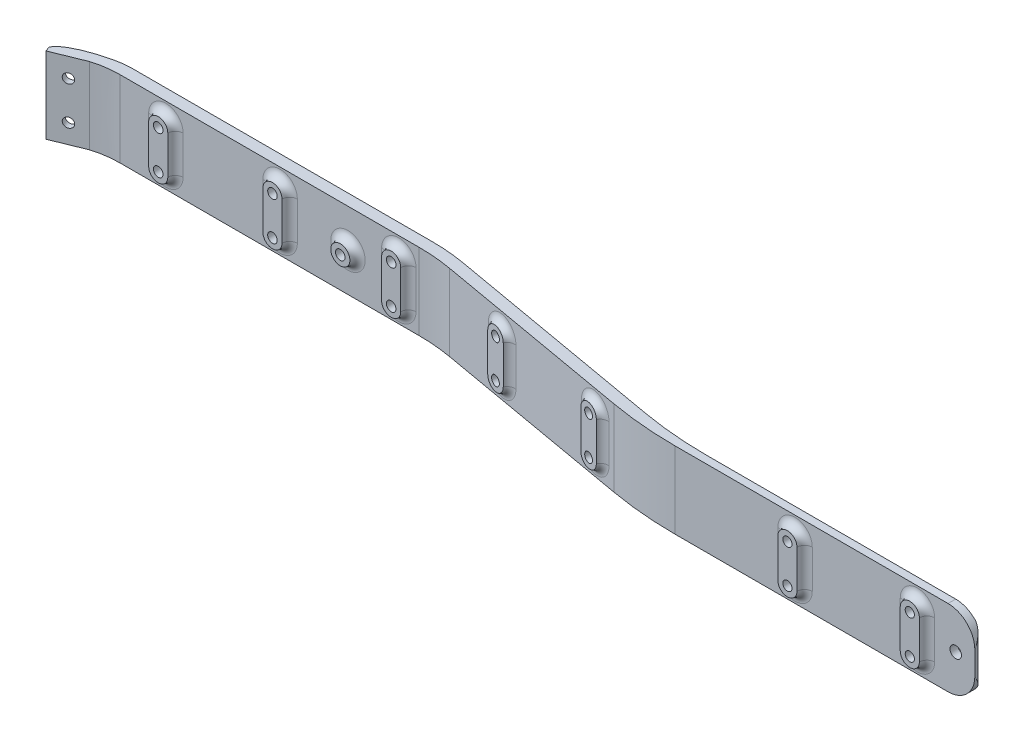
from build123d import *

# Parameters (mm, degrees)
EXTRUDE_1_DEPTH     = 20
SKETCH_2_R          = 1.25
SKETCH_2_R_2        = 1.2
SKETCH_2_R_3        = 1.5
CUT_EXTRUDE_1_DEPTH = 20
SKETCH_3_R          = 1.25
CUT_EXTRUDE_2_DEPTH = 10
SKETCH_6_R          = 1.25
CUT_EXTRUDE_3_DEPTH = 10
CUT_EXTRUDE_START   = -1.5
SKETCH_7_R          = 2.5
CUT_EXTRUDE_4_DEPTH = 10
FILLET_2_R          = 7
FILLET_4_R          = 2
SKETCH_8_R          = 2.5
SKETCH_8_R_2        = 1.25
EXTRUDE_2_DEPTH     = 2
SKETCH_9_R          = 1.2
EXTRUDE_3_DEPTH     = 2
SKETCH_10_R         = 1.25
EXTRUDE_4_DEPTH     = 1.5
FILLET_5_R          = 2


with BuildPart() as part:
    # Эскиз1 → Бобышка-Вытянуть1 (new body)
    with BuildSketch(Plane(origin=(0, 0, 0), x_dir=(1, 0, 0), z_dir=(0, 1, 0))):
        with BuildLine():
            add(Edge.make_bspline(
                [(11.586456911, 0), (7.354184674, -0.068879004), (-2.292700231, -2.973629634), (-3.594429032, -6.084373142)],
                knots=[0.023541254, 0.023541254, 0.023541254, 0.023541254, 1, 1, 1, 1], degree=3))
            Line((-3.594429032, -6.084373142), (-3.125717465, -7.311245307))
            Line((-3.125717465, -7.311245307), (4.944424909, -4.027038302))
            add(Edge.make_bspline(
                [(4.944424909, -4.027038302), (8.036327036, -3.034882344), (11.882927706, -3)],
                knots=[0, 0, 0, 1, 1, 1], degree=2))
            Line((11.882927706, -3), (90.096585882, -3))
            ThreePointArc((90.096585882, -3), (94.454373019, -3.190265095), (98.778994765, -3.759612349))
            Line((98.778994765, -3.759612349), (151.074808569, -12.980775301))
            ThreePointArc((151.074808569, -12.980775301), (159.724052061, -14.119469809), (168.439626336, -14.5))
            Line((168.439626336, -14.5), (246.882927706, -14.5))
            Line((246.882927706, -14.5), (246.882927706, -12.5))
            Line((246.882927706, -12.5), (174.639889098, -12.5))
            ThreePointArc((174.639889098, -12.5), (165.924314823, -12.119469809), (157.275071331, -10.980775301))
            Line((157.275071331, -10.980775301), (99.307975707, -0.759612349))
            ThreePointArc((99.307975707, -0.759612349), (97.143592887, -0.426667086), (94.966707435, -0.188811516))
            ThreePointArc((94.966707435, -0.188811516), (92.798189179, -0.047225181), (90.625566824, 0))
            Line((90.625566824, 0), (11.586456911, 0))
        make_face()
    extrude(amount=EXTRUDE_1_DEPTH)

    # Эскиз2 → Вырез-Вытянуть1 (cut)
    with BuildSketch(Plane(origin=(0, 0, 0), x_dir=(-1, 0, 0), z_dir=(0, 0, -1))):
        with Locations((-23.901835852, 5)):
            Circle(SKETCH_2_R)
        with Locations((-23.901835852, 15)):
            Circle(SKETCH_2_R)
        with Locations((-53.767576073, 15)):
            Circle(SKETCH_2_R)
        with Locations((-53.767576073, 5)):
            Circle(SKETCH_2_R)
        with Locations((-71.5, 10)):
            Circle(SKETCH_2_R)
        with Locations((-84.8, 15)):
            Circle(SKETCH_2_R)
        with Locations((-84.8, 5)):
            Circle(SKETCH_2_R)
        with Locations((-231.882927706, 5)):
            Circle(SKETCH_2_R_2)
        with Locations((-199.882927706, 5)):
            Circle(SKETCH_2_R_2)
        with Locations((-199.882927706, 15)):
            Circle(SKETCH_2_R_2)
        with Locations((-231.882927706, 15)):
            Circle(SKETCH_2_R_2)
        with Locations((-241.882927706, 10)):
            Circle(SKETCH_2_R_3)
    extrude(amount=-CUT_EXTRUDE_1_DEPTH, mode=Mode.SUBTRACT)

    # Эскиз3 → Вырез-Вытянуть2 (cut)
    with BuildSketch(Plane(origin=(2.864600513, 0, -16.245956808), x_dir=(-0.9848077530122085, 0, -0.17364817766692825), z_dir=(0.17364817766692825, 0, -0.9848077530122085))):
        with Locations((-114.931169712, 15)):
            Circle(SKETCH_3_R)
        with Locations((-144.931169712, 15)):
            Circle(SKETCH_3_R)
        with Locations((-114.931169712, 5)):
            Circle(SKETCH_3_R)
        with Locations((-144.931169712, 5)):
            Circle(SKETCH_3_R)
    extrude(amount=-CUT_EXTRUDE_2_DEPTH, mode=Mode.SUBTRACT)

    # Эскиз6 → Вырез-Вытянуть3 (cut)
    with BuildSketch(Plane(origin=(2.107232026, 0, 5.181655942), x_dir=(0.926237816407285, 0, -0.37693966023365694), z_dir=(0.3769396602336569, 0, 0.9262378164072849))):
        with Locations((-1.149682401, 15)):
            Circle(SKETCH_6_R)
        with Locations((-1.149682401, 5)):
            Circle(SKETCH_6_R)
    extrude(amount=-CUT_EXTRUDE_3_DEPTH, mode=Mode.SUBTRACT)

    # Эскиз7 → Вырез-Вытянуть4 (cut)
    with BuildSketch(Plane(origin=(2.107232026, 0, 5.181655942), x_dir=(0.926237816407285, 0, -0.37693966023365694), z_dir=(0.3769396602336569, 0, 0.9262378164072849)).offset(CUT_EXTRUDE_START)):
        with Locations((-1.149682401, 15)):
            Circle(SKETCH_7_R)
        with Locations((-1.149682401, 5)):
            Circle(SKETCH_7_R)
    extrude(amount=-CUT_EXTRUDE_4_DEPTH, mode=Mode.SUBTRACT)

    # Скругление2
    fillet_2_edges = [part.edges().sort_by_distance(p)[0] for p in [
        (246.882927706, 0, 13.5),
        (246.882927706, 20, 13.5),
    ]]
    fillet(fillet_2_edges, radius=FILLET_2_R)

    # Скругление4
    # the kernel refuses this fillet: 2 mm, written as the material it takes off along each edge
    with BuildSketch(Plane(origin=(246.882927706, 2, 12.5), x_dir=(0, 0, 1), z_dir=(0, 1, 0))) as fillet_4_piece_1:
        with BuildLine():
            CenterArc((FILLET_4_R, -FILLET_4_R), FILLET_4_R, 90, 90)
            Line((0, -FILLET_4_R), (0, 0))
            Line((0, 0), (FILLET_4_R, 0))
        make_face()
    extrude(amount=16, mode=Mode.SUBTRACT)

    # Эскиз8 → Бобышка-Вытянуть2 (add)
    # profile 1 of 4: a face of its own
    with BuildSketch(Plane.XY.offset(3)):
        with Locations((71.5, 10)):
            Circle(SKETCH_8_R)
        with Locations(Location((71.5, 10, 0), (0, 0, 180))):
            Circle(SKETCH_8_R_2, mode=Mode.SUBTRACT)
    # profile 2 of 4: a face of its own
    with BuildSketch(Plane.XY.offset(3)):
        with BuildLine():
            Line((21.401835852, 15), (21.401835852, 5))
            ThreePointArc((21.401835852, 5), (23.901835852, 2.5), (26.401835852, 5))
            Line((26.401835852, 5), (26.401835852, 15))
            ThreePointArc((26.401835852, 15), (23.901835852, 17.5), (21.401835852, 15))
        make_face()
        with Locations(Location((23.901835852, 15, 0), (0, 0, 180))):
            Circle(SKETCH_8_R_2, mode=Mode.SUBTRACT)
        with Locations(Location((23.901835852, 5, 0), (0, 0, 180))):
            Circle(SKETCH_8_R_2, mode=Mode.SUBTRACT)
    # profile 3 of 4: a face of its own
    with BuildSketch(Plane.XY.offset(3)):
        with BuildLine():
            Line((56.267576073, 5), (56.267576073, 15))
            ThreePointArc((56.267576073, 15), (53.767576073, 17.5), (51.267576073, 15))
            Line((51.267576073, 15), (51.267576073, 5))
            ThreePointArc((51.267576073, 5), (53.767576073, 2.5), (56.267576073, 5))
        make_face()
        with Locations(Location((53.767576073, 15, 0), (0, 0, 180))):
            Circle(SKETCH_8_R_2, mode=Mode.SUBTRACT)
        with Locations(Location((53.767576073, 5, 0), (0, 0, 180))):
            Circle(SKETCH_8_R_2, mode=Mode.SUBTRACT)
    # profile 4 of 4: a face of its own
    with BuildSketch(Plane.XY.offset(3)):
        with BuildLine():
            Line((87.3, 5), (87.3, 15))
            ThreePointArc((87.3, 15), (84.8, 17.5), (82.3, 15))
            Line((82.3, 15), (82.3, 5))
            ThreePointArc((82.3, 5), (84.8, 2.5), (87.3, 5))
        make_face()
        with Locations(Location((84.8, 15, 0), (0, 0, 180))):
            Circle(SKETCH_8_R_2, mode=Mode.SUBTRACT)
        with Locations(Location((84.8, 5, 0), (0, 0, 180))):
            Circle(SKETCH_8_R_2, mode=Mode.SUBTRACT)
    extrude(amount=EXTRUDE_2_DEPTH)

    # Эскиз9 → Бобышка-Вытянуть3 (add)
    # profile 1 of 2: a face of its own
    with BuildSketch(Plane.XY.offset(14.5)):
        with BuildLine():
            Line((197.382927706, 15), (197.382927706, 5))
            ThreePointArc((197.382927706, 5), (199.882927706, 2.5), (202.382927706, 5))
            Line((202.382927706, 5), (202.382927706, 15))
            ThreePointArc((202.382927706, 15), (199.882927706, 17.5), (197.382927706, 15))
        make_face()
        with Locations(Location((199.882927706, 15, 0), (0, 0, 180))):
            Circle(SKETCH_9_R, mode=Mode.SUBTRACT)
        with Locations(Location((199.882927706, 5, 0), (0, 0, 180))):
            Circle(SKETCH_9_R, mode=Mode.SUBTRACT)
    # profile 2 of 2: a face of its own
    with BuildSketch(Plane.XY.offset(14.5)):
        with BuildLine():
            Line((234.382927706, 5), (234.382927706, 15))
            ThreePointArc((234.382927706, 15), (231.882927706, 17.5), (229.382927706, 15))
            Line((229.382927706, 15), (229.382927706, 5))
            ThreePointArc((229.382927706, 5), (231.882927706, 2.5), (234.382927706, 5))
        make_face()
        with Locations(Location((231.882927706, 15, 0), (0, 0, 180))):
            Circle(SKETCH_9_R, mode=Mode.SUBTRACT)
        with Locations(Location((231.882927706, 5, 0), (0, 0, 180))):
            Circle(SKETCH_9_R, mode=Mode.SUBTRACT)
    extrude(amount=EXTRUDE_3_DEPTH)

    # Эскиз10 → Бобышка-Вытянуть4 (add)
    # profile 1 of 2: a face of its own
    with BuildSketch(Plane(origin=(2.335619571, 0, -13.245956808), x_dir=(0.9848077530122086, 0, 0.17364817766692767), z_dir=(-0.17364817766692767, 0, 0.9848077530122087))):
        with BuildLine():
            Line((112.431169712, 15), (112.431169712, 5))
            ThreePointArc((112.431169712, 5), (114.931169712, 2.5), (117.431169712, 5))
            Line((117.431169712, 5), (117.431169712, 15))
            ThreePointArc((117.431169712, 15), (114.931169712, 17.5), (112.431169712, 15))
        make_face()
        with Locations(Location((114.931169712, 15, 0), (0, 0, 180))):
            Circle(SKETCH_10_R, mode=Mode.SUBTRACT)
        with Locations(Location((114.931169712, 5, 0), (0, 0, 180))):
            Circle(SKETCH_10_R, mode=Mode.SUBTRACT)
    # profile 2 of 2: a face of its own
    with BuildSketch(Plane(origin=(2.335619571, 0, -13.245956808), x_dir=(0.9848077530122086, 0, 0.17364817766692767), z_dir=(-0.17364817766692767, 0, 0.9848077530122087))):
        with BuildLine():
            Line((142.431169712, 15), (142.431169712, 5))
            ThreePointArc((142.431169712, 5), (144.931169712, 2.5), (147.431169712, 5))
            Line((147.431169712, 5), (147.431169712, 15))
            ThreePointArc((147.431169712, 15), (144.931169712, 17.5), (142.431169712, 15))
        make_face()
        with Locations(Location((144.931169712, 5, 0), (0, 0, 180))):
            Circle(SKETCH_10_R, mode=Mode.SUBTRACT)
        with Locations(Location((144.931169712, 15, 0), (0, 0, 180))):
            Circle(SKETCH_10_R, mode=Mode.SUBTRACT)
    extrude(amount=EXTRUDE_4_DEPTH)

    # Скругление5
    # the kernel refuses this fillet: 2 mm, written as the material it adds along each edge
    with BuildSketch(Plane(origin=(23.901835852, 15, 3), x_dir=(1, 0, 0), z_dir=(0, -1, 0))) as fillet_5_piece_1:
        with BuildLine():
            CenterArc((2.5 + FILLET_5_R, FILLET_5_R), FILLET_5_R, 180, 90)
            Line((2.5, FILLET_5_R), (2.5 - FILLET_5_R * 0.02, FILLET_5_R))
            Line((2.5 - FILLET_5_R * 0.02, FILLET_5_R), (2.5 - FILLET_5_R * 0.02, -FILLET_5_R * 0.02))
            Line((2.5 - FILLET_5_R * 0.02, -FILLET_5_R * 0.02), (2.5 + FILLET_5_R, -FILLET_5_R * 0.02))
            Line((2.5 + FILLET_5_R, -FILLET_5_R * 0.02), (2.5 + FILLET_5_R, 0))
        make_face()
    revolve(axis=Axis((23.901835852, 15, 3), (0, 0, 1)), revolution_arc=180)
    with BuildSketch(Plane(origin=(26.401835852, 5, 3), x_dir=(1, 0, 0), z_dir=(0, 1, 0)), Plane(origin=(21.401835852, 15, 3), x_dir=(-1, 0, 0), z_dir=(0, -1, 0)), Plane(origin=(234.382927706, 5, 14.5), x_dir=(1, 0, 0), z_dir=(0, 1, 0)), Plane(origin=(202.382927706, 5, 14.5), x_dir=(1, 0, 0), z_dir=(0, 1, 0)), Plane(origin=(87.3, 5, 3), x_dir=(1, 0, 0), z_dir=(0, 1, 0)), Plane(origin=(56.267576073, 5, 3), x_dir=(1, 0, 0), z_dir=(0, 1, 0)), Plane(origin=(229.382927706, 15, 14.5), x_dir=(-1, 0, 0), z_dir=(0, -1, 0)), Plane(origin=(197.382927706, 15, 14.5), x_dir=(-1, 0, 0), z_dir=(0, -1, 0)), Plane(origin=(82.3, 15, 3), x_dir=(-1, 0, 0), z_dir=(0, -1, 0)), Plane(origin=(51.267576073, 15, 3), x_dir=(-1, 0, 0), z_dir=(0, -1, 0))) as fillet_5_piece_2:
        with BuildLine():
            CenterArc((FILLET_5_R, -FILLET_5_R), FILLET_5_R, 90, 90)
            Line((0, -FILLET_5_R), (-FILLET_5_R * 0.02, -FILLET_5_R))
            Line((-FILLET_5_R * 0.02, -FILLET_5_R), (-FILLET_5_R * 0.02, FILLET_5_R * 0.02))
            Line((-FILLET_5_R * 0.02, FILLET_5_R * 0.02), (FILLET_5_R, FILLET_5_R * 0.02))
            Line((FILLET_5_R, FILLET_5_R * 0.02), (FILLET_5_R, 0))
        make_face()
    extrude(amount=10)
    with BuildSketch(Plane(origin=(23.901835852, 5, 3), x_dir=(-1, 0, 0), z_dir=(0, 1, 0))) as fillet_5_piece_3:
        with BuildLine():
            CenterArc((2.5 + FILLET_5_R, FILLET_5_R), FILLET_5_R, 180, 90)
            Line((2.5, FILLET_5_R), (2.5 - FILLET_5_R * 0.02, FILLET_5_R))
            Line((2.5 - FILLET_5_R * 0.02, FILLET_5_R), (2.5 - FILLET_5_R * 0.02, -FILLET_5_R * 0.02))
            Line((2.5 - FILLET_5_R * 0.02, -FILLET_5_R * 0.02), (2.5 + FILLET_5_R, -FILLET_5_R * 0.02))
            Line((2.5 + FILLET_5_R, -FILLET_5_R * 0.02), (2.5 + FILLET_5_R, 0))
        make_face()
    revolve(axis=Axis((23.901835852, 5, 3), (0, 0, 1)), revolution_arc=180)
    with BuildSketch(Plane(origin=(231.882927706, 15, 14.5), x_dir=(1, 0, 0), z_dir=(0, -1, 0))) as fillet_5_piece_4:
        with BuildLine():
            CenterArc((2.5 + FILLET_5_R, FILLET_5_R), FILLET_5_R, 180, 90)
            Line((2.5, FILLET_5_R), (2.5 - FILLET_5_R * 0.02, FILLET_5_R))
            Line((2.5 - FILLET_5_R * 0.02, FILLET_5_R), (2.5 - FILLET_5_R * 0.02, -FILLET_5_R * 0.02))
            Line((2.5 - FILLET_5_R * 0.02, -FILLET_5_R * 0.02), (2.5 + FILLET_5_R, -FILLET_5_R * 0.0200000000001))
            Line((2.5 + FILLET_5_R, -FILLET_5_R * 0.0200000000001), (2.5 + FILLET_5_R, 0))
        make_face()
    revolve(axis=Axis((231.882927706, 15, 14.5), (0, 0, 1)), revolution_arc=180)
    with BuildSketch(Plane(origin=(231.882927706, 5, 14.5), x_dir=(-1, 0, 0), z_dir=(0, 1, 0))) as fillet_5_piece_5:
        with BuildLine():
            CenterArc((2.5 + FILLET_5_R, FILLET_5_R), FILLET_5_R, 180, 90)
            Line((2.5, FILLET_5_R), (2.5 - FILLET_5_R * 0.02, FILLET_5_R))
            Line((2.5 - FILLET_5_R * 0.02, FILLET_5_R), (2.5 - FILLET_5_R * 0.02, -FILLET_5_R * 0.02))
            Line((2.5 - FILLET_5_R * 0.02, -FILLET_5_R * 0.02), (2.5 + FILLET_5_R, -FILLET_5_R * 0.0200000000001))
            Line((2.5 + FILLET_5_R, -FILLET_5_R * 0.0200000000001), (2.5 + FILLET_5_R, 0))
        make_face()
    revolve(axis=Axis((231.882927706, 5, 14.5), (0, 0, 1)), revolution_arc=180)
    with BuildSketch(Plane(origin=(199.882927706, 15, 14.5), x_dir=(1, 0, 0), z_dir=(0, -1, 0))) as fillet_5_piece_6:
        with BuildLine():
            CenterArc((2.5 + FILLET_5_R, FILLET_5_R), FILLET_5_R, 180, 90)
            Line((2.5, FILLET_5_R), (2.5 - FILLET_5_R * 0.02, FILLET_5_R))
            Line((2.5 - FILLET_5_R * 0.02, FILLET_5_R), (2.5 - FILLET_5_R * 0.02, -FILLET_5_R * 0.02))
            Line((2.5 - FILLET_5_R * 0.02, -FILLET_5_R * 0.02), (2.5 + FILLET_5_R, -FILLET_5_R * 0.0200000000001))
            Line((2.5 + FILLET_5_R, -FILLET_5_R * 0.0200000000001), (2.5 + FILLET_5_R, 0))
        make_face()
    revolve(axis=Axis((199.882927706, 15, 14.5), (0, 0, 1)), revolution_arc=180)
    with BuildSketch(Plane(origin=(199.882927706, 5, 14.5), x_dir=(-1, 0, 0), z_dir=(0, 1, 0))) as fillet_5_piece_7:
        with BuildLine():
            CenterArc((2.5 + FILLET_5_R, FILLET_5_R), FILLET_5_R, 180, 90)
            Line((2.5, FILLET_5_R), (2.5 - FILLET_5_R * 0.02, FILLET_5_R))
            Line((2.5 - FILLET_5_R * 0.02, FILLET_5_R), (2.5 - FILLET_5_R * 0.02, -FILLET_5_R * 0.02))
            Line((2.5 - FILLET_5_R * 0.02, -FILLET_5_R * 0.02), (2.5 + FILLET_5_R, -FILLET_5_R * 0.0200000000001))
            Line((2.5 + FILLET_5_R, -FILLET_5_R * 0.0200000000001), (2.5 + FILLET_5_R, 0))
        make_face()
    revolve(axis=Axis((199.882927706, 5, 14.5), (0, 0, 1)), revolution_arc=180)
    with BuildSketch(Plane(origin=(145.064959156, 15, 11.9210767), x_dir=(0.9848077530122088, 0, 0.17364817766692653), z_dir=(0, -1, 0))) as fillet_5_piece_8:
        with BuildLine():
            CenterArc((4.436491673, 2), FILLET_5_R, 194.477512186, 75.522487814)
            Line((2.5, 1.5), (2.461270167, 1.49))
            ThreePointArc((2.461270167, 1.49), (2.46, 0.75), (2.46, 0))
            Line((2.46, 0), (2.5, -0.04))
            Line((2.5, -0.04), (4.436491673, -0.04))
            Line((4.436491673, -0.04), (4.436491673, 0))
        make_face()
    revolve(axis=Axis((145.064959156, 15, 11.9210767), (-0.17364817766692767, 0, 0.9848077530122087)), revolution_arc=180)
    with BuildSketch(Plane(origin=(147.526978539, 5, 12.355197144), x_dir=(0.9848077530122076, 0, 0.17364817766693302), z_dir=(0, 1, 0)), Plane(origin=(117.982745949, 5, 7.145751814), x_dir=(0.9848077530122087, -2.8421709430404017e-15, 0.1736481776669272), z_dir=(0, 1, 0)), Plane(origin=(142.602939774, 15, 11.486956256), x_dir=(-0.9848077530122094, 0, -0.17364817766692311), z_dir=(0, -1, 0)), Plane(origin=(113.058707184, 15, 6.277510926), x_dir=(-0.9848077530122087, 0, -0.17364817766692664), z_dir=(0, -1, 0))) as fillet_5_piece_9:
        with BuildLine():
            CenterArc((1.936491673, -2), FILLET_5_R, 90, 75.522487814)
            Line((0, -1.5), (-0.038729833, -1.49))
            ThreePointArc((-0.038729833, -1.49), (-0.04, -0.75), (-0.04, 0))
            Line((-0.04, 0), (0, 0.04))
            Line((0, 0.04), (1.936491673, 0.04))
            Line((1.936491673, 0.04), (1.936491673, 0))
        make_face()
    extrude(amount=10)
    with BuildSketch(Plane(origin=(145.064959156, 5, 11.9210767), x_dir=(-0.9848077530122086, 0, -0.17364817766692708), z_dir=(0, 1, 0))) as fillet_5_piece_10:
        with BuildLine():
            CenterArc((4.436491673, 2), FILLET_5_R, 194.477512186, 75.522487814)
            Line((2.5, 1.5), (2.461270167, 1.49))
            ThreePointArc((2.461270167, 1.49), (2.46, 0.75), (2.46, 0))
            Line((2.46, 0), (2.5, -0.04))
            Line((2.5, -0.04), (4.436491673, -0.04))
            Line((4.436491673, -0.04), (4.436491673, 0))
        make_face()
    revolve(axis=Axis((145.064959156, 5, 11.9210767), (-0.17364817766692767, 0, 0.9848077530122087)), revolution_arc=180)
    with BuildSketch(Plane(origin=(115.520726566, 15, 6.71163137), x_dir=(0.9848077530122084, 2.8421709430403926e-15, 0.1736481776669289), z_dir=(0, -1, 0))) as fillet_5_piece_11:
        with BuildLine():
            CenterArc((4.436491673, 2), FILLET_5_R, 194.477512186, 75.522487814)
            Line((2.5, 1.5), (2.461270167, 1.49))
            ThreePointArc((2.461270167, 1.49), (2.46, 0.75), (2.46, 0))
            Line((2.46, 0), (2.5, -0.04))
            Line((2.5, -0.04), (4.436491673, -0.04))
            Line((4.436491673, -0.04), (4.436491673, 0))
        make_face()
    revolve(axis=Axis((115.520726566, 15, 6.71163137), (-0.17364817766692767, 0, 0.9848077530122087)), revolution_arc=180)
    with BuildSketch(Plane(origin=(115.520726566, 5, 6.71163137), x_dir=(-0.9848077530122086, 0, -0.1736481776669275), z_dir=(0, 1, 0))) as fillet_5_piece_12:
        with BuildLine():
            CenterArc((4.436491673, 2), FILLET_5_R, 194.477512186, 75.522487814)
            Line((2.5, 1.5), (2.461270167, 1.49))
            ThreePointArc((2.461270167, 1.49), (2.46, 0.75), (2.46, 0))
            Line((2.46, 0), (2.5, -0.04))
            Line((2.5, -0.04), (4.436491673, -0.04))
            Line((4.436491673, -0.04), (4.436491673, 0))
        make_face()
    revolve(axis=Axis((115.520726566, 5, 6.71163137), (-0.17364817766692767, 0, 0.9848077530122087)), revolution_arc=180)
    with BuildSketch(Plane(origin=(84.8, 15, 3), x_dir=(1, 0, 0), z_dir=(0, -1, 0))) as fillet_5_piece_13:
        with BuildLine():
            CenterArc((2.5 + FILLET_5_R, FILLET_5_R), FILLET_5_R, 180, 90)
            Line((2.5, FILLET_5_R), (2.5 - FILLET_5_R * 0.02, FILLET_5_R))
            Line((2.5 - FILLET_5_R * 0.02, FILLET_5_R), (2.5 - FILLET_5_R * 0.02, -FILLET_5_R * 0.02))
            Line((2.5 - FILLET_5_R * 0.02, -FILLET_5_R * 0.02), (2.5 + FILLET_5_R, -FILLET_5_R * 0.02))
            Line((2.5 + FILLET_5_R, -FILLET_5_R * 0.02), (2.5 + FILLET_5_R, 0))
        make_face()
    revolve(axis=Axis((84.8, 15, 3), (0, 0, 1)), revolution_arc=180)
    with BuildSketch(Plane(origin=(84.8, 5, 3), x_dir=(-1, 0, 0), z_dir=(0, 1, 0))) as fillet_5_piece_14:
        with BuildLine():
            CenterArc((2.5 + FILLET_5_R, FILLET_5_R), FILLET_5_R, 180, 90)
            Line((2.5, FILLET_5_R), (2.5 - FILLET_5_R * 0.02, FILLET_5_R))
            Line((2.5 - FILLET_5_R * 0.02, FILLET_5_R), (2.5 - FILLET_5_R * 0.02, -FILLET_5_R * 0.02))
            Line((2.5 - FILLET_5_R * 0.02, -FILLET_5_R * 0.02), (2.5 + FILLET_5_R, -FILLET_5_R * 0.02))
            Line((2.5 + FILLET_5_R, -FILLET_5_R * 0.02), (2.5 + FILLET_5_R, 0))
        make_face()
    revolve(axis=Axis((84.8, 5, 3), (0, 0, 1)), revolution_arc=180)
    with BuildSketch(Plane(origin=(53.767576073, 15, 3), x_dir=(1, 0, 0), z_dir=(0, -1, 0))) as fillet_5_piece_15:
        with BuildLine():
            CenterArc((2.5 + FILLET_5_R, FILLET_5_R), FILLET_5_R, 180, 90)
            Line((2.5, FILLET_5_R), (2.5 - FILLET_5_R * 0.02, FILLET_5_R))
            Line((2.5 - FILLET_5_R * 0.02, FILLET_5_R), (2.5 - FILLET_5_R * 0.02, -FILLET_5_R * 0.02))
            Line((2.5 - FILLET_5_R * 0.02, -FILLET_5_R * 0.02), (2.5 + FILLET_5_R, -FILLET_5_R * 0.02))
            Line((2.5 + FILLET_5_R, -FILLET_5_R * 0.02), (2.5 + FILLET_5_R, 0))
        make_face()
    revolve(axis=Axis((53.767576073, 15, 3), (0, 0, 1)), revolution_arc=180)
    with BuildSketch(Plane(origin=(53.767576073, 5, 3), x_dir=(-1, 0, 0), z_dir=(0, 1, 0))) as fillet_5_piece_16:
        with BuildLine():
            CenterArc((2.5 + FILLET_5_R, FILLET_5_R), FILLET_5_R, 180, 90)
            Line((2.5, FILLET_5_R), (2.5 - FILLET_5_R * 0.02, FILLET_5_R))
            Line((2.5 - FILLET_5_R * 0.02, FILLET_5_R), (2.5 - FILLET_5_R * 0.02, -FILLET_5_R * 0.02))
            Line((2.5 - FILLET_5_R * 0.02, -FILLET_5_R * 0.02), (2.5 + FILLET_5_R, -FILLET_5_R * 0.02))
            Line((2.5 + FILLET_5_R, -FILLET_5_R * 0.02), (2.5 + FILLET_5_R, 0))
        make_face()
    revolve(axis=Axis((53.767576073, 5, 3), (0, 0, 1)), revolution_arc=180)
    with BuildSketch(Plane(origin=(71.5, 10, 3), x_dir=(1, 0, 0), z_dir=(0, -1, 0))) as fillet_5_piece_17:
        with BuildLine():
            CenterArc((2.5 + FILLET_5_R, FILLET_5_R), FILLET_5_R, 180, 90)
            Line((2.5, FILLET_5_R), (2.5 - FILLET_5_R * 0.02, FILLET_5_R))
            Line((2.5 - FILLET_5_R * 0.02, FILLET_5_R), (2.5 - FILLET_5_R * 0.02, -FILLET_5_R * 0.02))
            Line((2.5 - FILLET_5_R * 0.02, -FILLET_5_R * 0.02), (2.5 + FILLET_5_R, -FILLET_5_R * 0.02))
            Line((2.5 + FILLET_5_R, -FILLET_5_R * 0.02), (2.5 + FILLET_5_R, 0))
        make_face()
    revolve(axis=Axis((71.5, 10, 3), (0, 0, 1)))


solid = part.part
